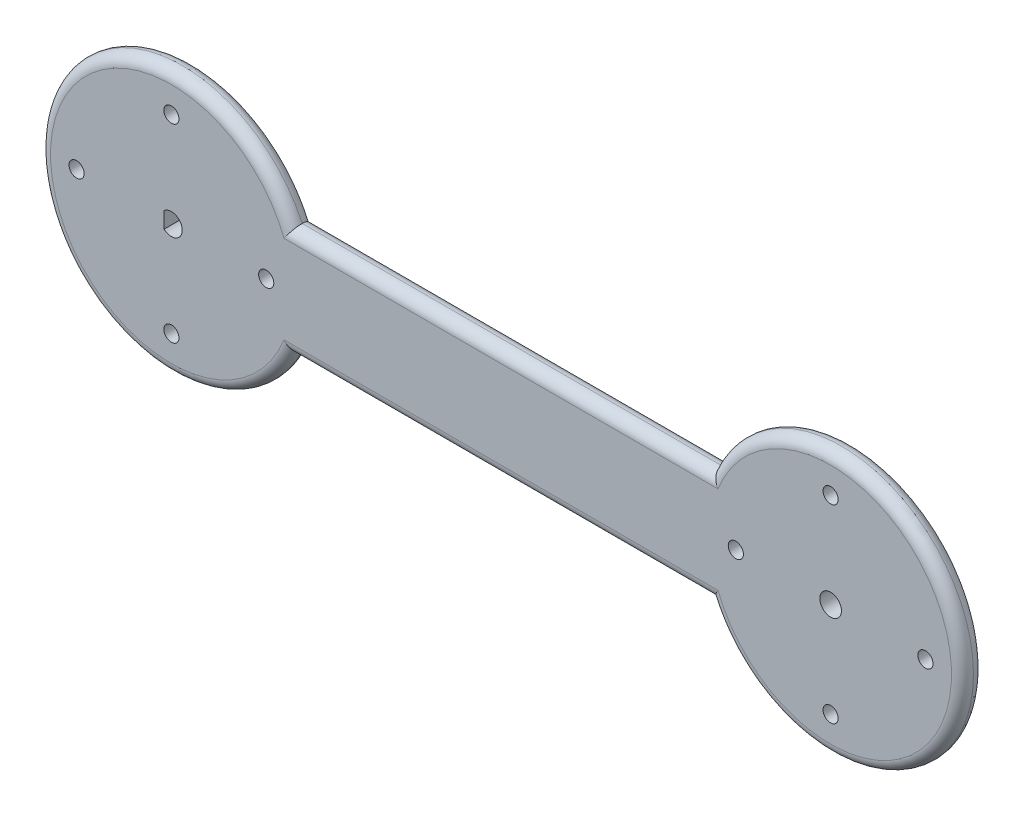
from build123d import *

# Parameters (mm, degrees)
SKETCH1_R           = 2.5019
BOSS_EXTRUDE1_DEPTH = 5.08
FILLET1_R           = 2.54
FILLET2_R           = 2.54
SKETCH2_R           = 1.75
CUT_EXTRUDE1_DEPTH  = 186.472184555


with BuildPart() as part:
    # Sketch1 → Boss-Extrude1 (new body)
    with BuildSketch(Plane.XY):
        with BuildLine():
            Line((27.708128771, -12.7), (124.691871229, -12.7))
            ThreePointArc((124.691871229, -12.7), (182.88, 0), (124.691871229, 12.7))
            Line((124.691871229, 12.7), (27.708128771, 12.7))
            ThreePointArc((27.708128771, 12.7), (-30.48, 0), (27.708128771, -12.7))
        make_face()
        with Locations((152.4, 0)):
            Circle(SKETCH1_R, mode=Mode.SUBTRACT)
        with BuildLine():
            Line((-1.67829283, 1.855488288), (-1.67829283, -1.855488288))
            ThreePointArc((-1.67829283, -1.855488288), (2.5019, 0), (-1.67829283, 1.855488288))
        make_face(mode=Mode.SUBTRACT)
    extrude(amount=BOSS_EXTRUDE1_DEPTH)

    # Fillet1
    fillet1_edges = [part.edges().sort_by_distance(p)[0] for p in [
        (-30.48, 0, 5.08),
        (76.2, -12.7, 5.08),
        (182.88, 0, 5.08),
        (76.2, 12.7, 5.08),
    ]]
    fillet(fillet1_edges, radius=FILLET1_R)

    # Fillet2
    fillet2_edges = [part.edges().sort_by_distance(p)[0] for p in [
        (76.2, -12.7, 0),
        (-30.48, 0, 0),
        (76.2, 12.7, 0),
        (182.88, 0, 0),
    ]]
    fillet(fillet2_edges, radius=FILLET2_R - 0.0001)  # a hair under: the kernel refuses the full size

    # Sketch2 → Cut-Extrude1 (cut, through all)
    with BuildSketch(Plane.XY.offset(5.08)):
        with Locations((21.920310217, 0)):
            Circle(SKETCH2_R)
        with Locations((0, -21.920310217)):
            Circle(SKETCH2_R)
        with Locations((-21.920310217, 0)):
            Circle(SKETCH2_R)
        with Locations((0, 21.920310217)):
            Circle(SKETCH2_R)
    cut_extrude1 = extrude(amount=-CUT_EXTRUDE1_DEPTH, mode=Mode.SUBTRACT)

    # Mirror1: Cut-Extrude1 across plane
    add(cut_extrude1.mirror(Plane(origin=(76.2, 0, 0), x_dir=(0, 0, 1), z_dir=(1, 0, 0))), mode=Mode.SUBTRACT)


solid = part.part
